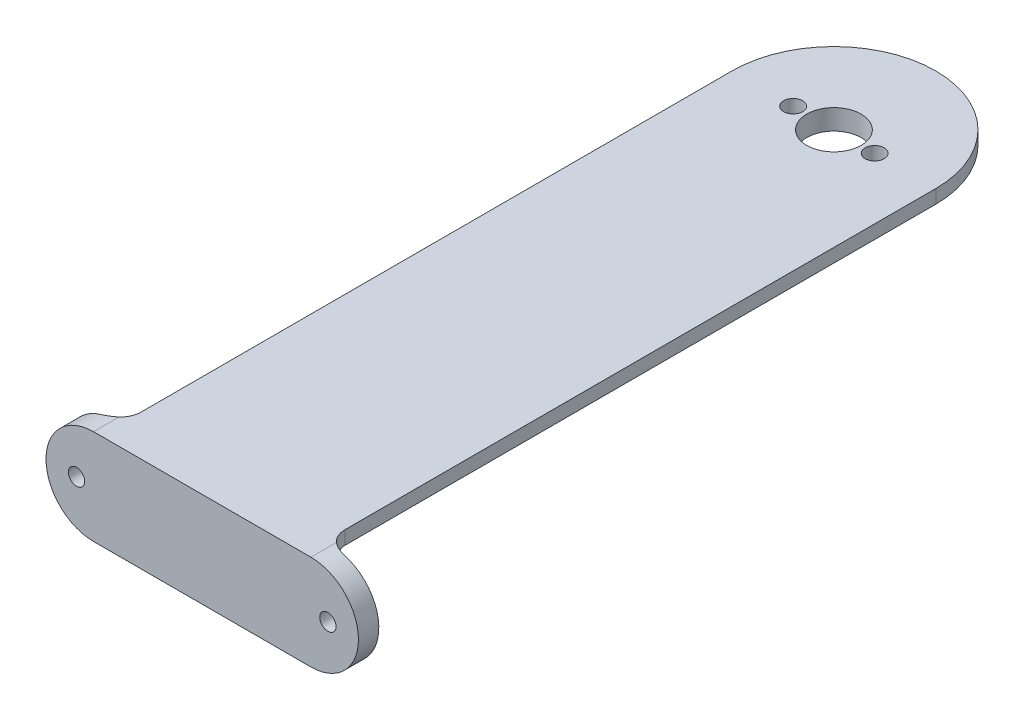
from build123d import *

# Parameters (mm, degrees)
ESQUISSE1_R             = 4
BOSS_EXTRU_1_DEPTH      = 2
BOSS_EXTRU_2_START      = 1
ESQUISSE2_R             = 7.75
ESQUISSE2_R_2           = 4
BOSS_EXTRU_2_DEPTH      = 1
ESQUISSE3_R             = 3.75
BOSS_EXTRU_3_DEPTH      = 3
CONG_1_R                = 1
ESQUISSE4_R             = 1.4
ENL_V_MAT_EXTRU_1_DEPTH = 92.378334412
ESQUISSE5_R             = 1.2
BOSS_EXTRU_4_DEPTH      = 3
CONG_2_R                = 3


with BuildPart() as part:
    # Esquisse1 → Boss.-Extru.1 (new body)
    with BuildSketch(Plane(origin=(0, 0, 0), x_dir=(1, 0, 0), z_dir=(0, 1, 0))):
        with BuildLine():
            Line((-15, 0), (-15, -90))
            Line((-15, -90), (15, -90))
            Line((15, -90), (15, 0))
            ThreePointArc((15, 0), (0, 15), (-15, 0))
        make_face()
        Circle(ESQUISSE1_R, mode=Mode.SUBTRACT)
    extrude(amount=BOSS_EXTRU_1_DEPTH)

    # Esquisse2 → Boss.-Extru.2 (add)
    with BuildSketch(Plane.XZ.offset(BOSS_EXTRU_2_START)):
        Circle(ESQUISSE2_R)
        Circle(ESQUISSE2_R_2, mode=Mode.SUBTRACT)
    extrude(amount=-BOSS_EXTRU_2_DEPTH)

    # Esquisse3 → Boss.-Extru.3 (add)
    with BuildSketch(Plane.XZ):
        with Locations((0, 65)):
            Circle(ESQUISSE3_R)
    extrude(amount=BOSS_EXTRU_3_DEPTH)

    # Congé1
    cong_1_edges = [part.edges().sort_by_distance(p)[0] for p in [
        (-3.75, -3, 65),
    ]]
    fillet(cong_1_edges, radius=CONG_1_R)

    # Esquisse4 → Enlèv. mat.-Extru.1 (cut, through all)
    with BuildSketch(Plane(origin=(0, 2, 0), x_dir=(1, 0, 0), z_dir=(0, 1, 0))):
        with Locations((6, 0)):
            Circle(ESQUISSE4_R)
        with Locations((-6, 0)):
            Circle(ESQUISSE4_R)
    extrude(amount=-ENL_V_MAT_EXTRU_1_DEPTH, mode=Mode.SUBTRACT)

    # Esquisse5 → Boss.-Extru.4 (add)
    with BuildSketch(Plane.XY.offset(90)):
        with BuildLine():
            Line((-16, 2), (16, 2))
            ThreePointArc((16, 2), (23, -5), (16, -12))
            Line((16, -12), (-16, -12))
            ThreePointArc((-16, -12), (-23, -5), (-16, 2))
        make_face()
        with Locations((-18.5, -5)):
            Circle(ESQUISSE5_R, mode=Mode.SUBTRACT)
        with Locations((18.5, -5)):
            Circle(ESQUISSE5_R, mode=Mode.SUBTRACT)
    extrude(amount=BOSS_EXTRU_4_DEPTH)

    # Congé2
    cong_2_edges = [part.edges().sort_by_distance(p)[0] for p in [
        (15, 1, 90),
        (0, 0, 90),
        (-15, 1, 90),
    ]]
    fillet(cong_2_edges, radius=CONG_2_R)


solid = part.part
